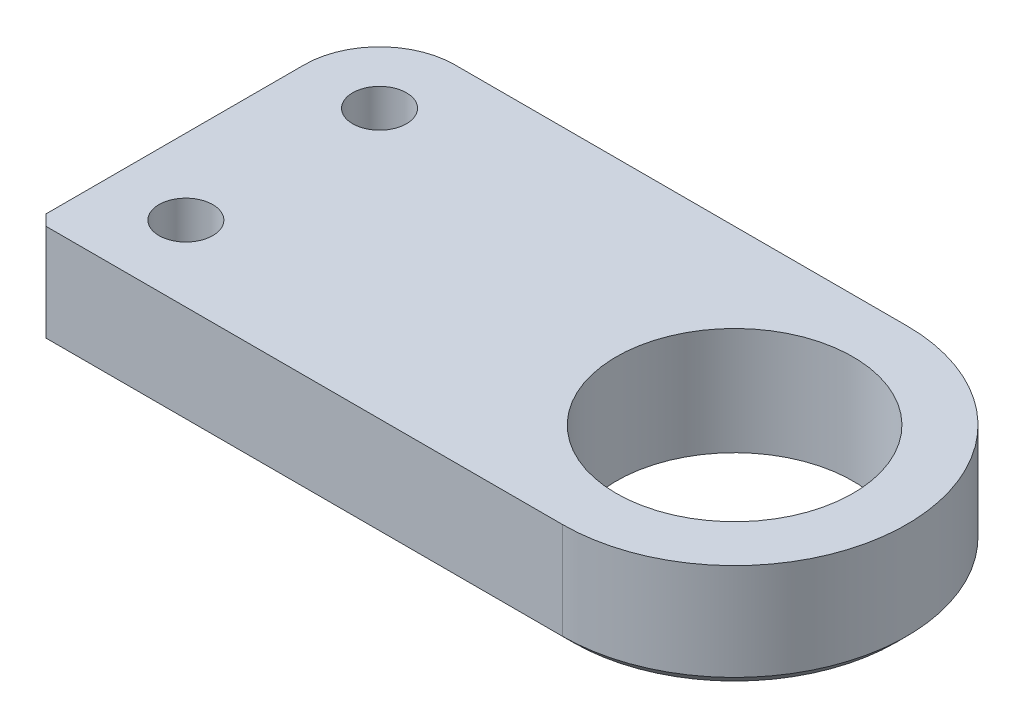
from build123d import *

# Parameters (mm, degrees)
SKETCH_1_R      = 11
SKETCH_1_R_2    = 2.5
EXTRUDE_1_DEPTH = 10
CHAMFER_1_SIZE  = 1


with BuildPart() as part:
    # 草图1 → 凸台-拉伸1 (new body)
    with BuildSketch(Plane(origin=(0, 0, 0), x_dir=(1, 0, 0), z_dir=(0, 1, 0))):
        with BuildLine():
            Line((0, 16), (-42, 16))
            ThreePointArc((-42, 16), (-46.949747468, 13.949747468), (-49, 9))
            Line((-49, 9), (-49, -15))
            Line((-49, -15), (-48, -16))
            Line((-48, -16), (0, -16))
            ThreePointArc((0, -16), (16, 0), (0, 16))
        make_face()
        with Locations(Location((0, 0, 0), (0, 0, 270))):
            Circle(SKETCH_1_R, mode=Mode.SUBTRACT)
        with Locations(Location((-42, 9, 0), (0, 0, 270))):
            Circle(SKETCH_1_R_2, mode=Mode.SUBTRACT)
        with Locations(Location((-42, -9, 0), (0, 0, 270))):
            Circle(SKETCH_1_R_2, mode=Mode.SUBTRACT)
    extrude(amount=EXTRUDE_1_DEPTH)

    # 倒角1
    # the kernel refuses this chamfer: 1 mm, written as the material it takes off along each edge
    with BuildSketch(Plane(origin=(-50.571682988, 0, 16), x_dir=(0, 0.9996219169112968, 0.02749587661058563), z_dir=(1, 0, 0))) as chamfer_1_piece_1:
        Polygon((CHAMFER_1_SIZE * 0.999621916911, -CHAMFER_1_SIZE * 0.0274958766106), (-CHAMFER_1_SIZE * 0.0274958766106, -CHAMFER_1_SIZE * 0.999621916911), (0, 0), align=None)
    extrude(amount=50.571682988, mode=Mode.SUBTRACT)
    with BuildSketch(Plane(origin=(0, 0, 0), x_dir=(0, 0, 1), z_dir=(-1, 0, 0))) as chamfer_1_piece_2:
        Polygon((16, CHAMFER_1_SIZE), (16 - CHAMFER_1_SIZE, 0), (16, 0), align=None)
    revolve(axis=Axis((0, 0, 0), (0, 1, 0)), revolution_arc=180, mode=Mode.SUBTRACT)
    with BuildSketch(Plane(origin=(0, 0, -16), x_dir=(0, 0.9996219169112968, -0.02749587661058563), z_dir=(-1, 0, 0))) as chamfer_1_piece_3:
        Polygon((CHAMFER_1_SIZE * 0.999621916911, -CHAMFER_1_SIZE * 0.0274958766106), (-CHAMFER_1_SIZE * 0.0274958766106, -CHAMFER_1_SIZE * 0.999621916911), (0, 0), align=None)
    extrude(amount=42, mode=Mode.SUBTRACT)
    with BuildSketch(Plane(origin=(-42, 0, -9), x_dir=(0, 0, -1), z_dir=(1, 0, 0))) as chamfer_1_piece_4:
        Polygon((7, CHAMFER_1_SIZE), (7 - CHAMFER_1_SIZE, 0), (7, 0), align=None)
    revolve(axis=Axis((-42, 0, -9), (0, 1, 0)), revolution_arc=90, mode=Mode.SUBTRACT)
    with BuildSketch(Plane(origin=(-49, 0, -9), x_dir=(-0.02749587661058908, 0.9996219169112968, 0), z_dir=(0, 0, 1))) as chamfer_1_piece_5:
        Polygon((CHAMFER_1_SIZE * 0.999621916911, -CHAMFER_1_SIZE * 0.0274958766106), (-CHAMFER_1_SIZE * 0.0274958766106, -CHAMFER_1_SIZE * 0.999621916911), (0, 0), align=None)
    extrude(amount=26.571682988, mode=Mode.SUBTRACT)


solid = part.part
